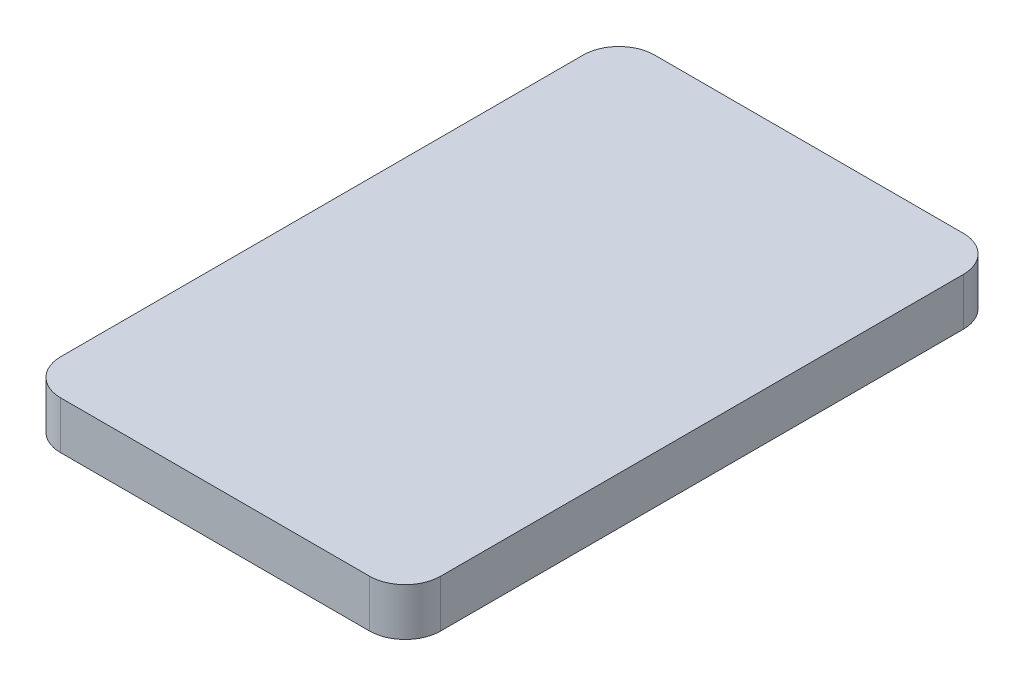
from build123d import *

# Parameters (mm, degrees)
SKETCH1_W           = 32
SKETCH1_H           = 50
BOSS_EXTRUDE1_DEPTH = 4
FILLET1_R           = 3


with BuildPart() as part:
    # Sketch1 → Boss-Extrude1 (new body)
    with BuildSketch(Plane(origin=(0, 0, 0), x_dir=(1, 0, 0), z_dir=(0, 1, 0))):
        with Locations((16, 25)):
            Rectangle(SKETCH1_W, SKETCH1_H)
    extrude(amount=BOSS_EXTRUDE1_DEPTH)

    # Fillet1
    fillet1_edges = [part.edges().sort_by_distance(p)[0] for p in [
        (0, 2, -50),
        (32, 2, -50),
        (0, 2, 0),
        (32, 2, 0),
    ]]
    fillet(fillet1_edges, radius=FILLET1_R)


solid = part.part
